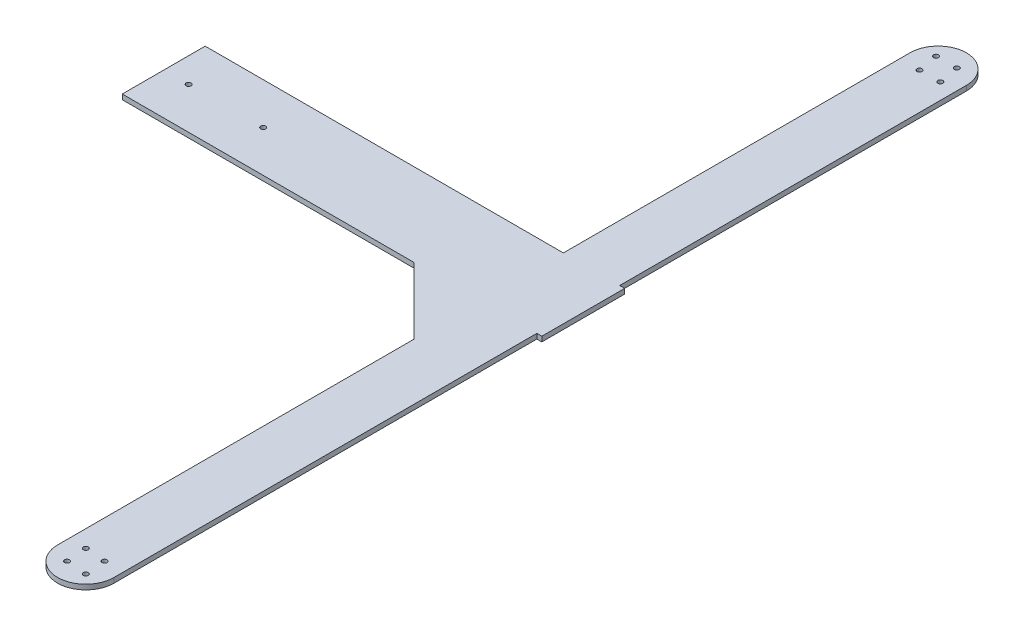
from build123d import *

# Parameters (mm, degrees)
SKETCH1_R           = 1.5
BOSS_EXTRUDE1_DEPTH = 3
SKETCH_3_W          = 50
SKETCH_3_H          = 3
EXTRUDE_1_DEPTH     = 3
SKETCH_4_R          = 1.5
CUT_EXTRUDE_1_DEPTH = 10
EXTRUDE_START       = -3
SKETCH_5_R          = 1.5
EXTRUDE_2_DEPTH     = 3


with BuildPart() as part:
    # Sketch1 → Boss-Extrude1 (new body)
    with BuildSketch(Plane(origin=(0, 0, 0), x_dir=(1, 0, 0), z_dir=(0, 1, 0))):
        with BuildLine():
            Line((0, 50), (0, 0))
            Line((0, 0), (176, 0))
            Line((176, 0), (216, -40))
            Line((216, -40), (216, -255))
            ThreePointArc((216, -255), (233, -272), (250, -255))
            Line((250, -255), (250, 259.060301809))
            ThreePointArc((250, 259.060301809), (233, 276.060301809), (216, 259.060301809))
            Line((216, 259.060301809), (216, 50))
            Line((216, 50), (0, 50))
        make_face()
        with Locations((227.343145751, -260.656854249)):
            Circle(SKETCH1_R, mode=Mode.SUBTRACT)
        with Locations((226.282485579, -248.282485579)):
            Circle(SKETCH1_R, mode=Mode.SUBTRACT)
        with Locations((239.717514421, -261.717514421)):
            Circle(SKETCH1_R, mode=Mode.SUBTRACT)
        with Locations((238.656854249, -249.343145751)):
            Circle(SKETCH1_R, mode=Mode.SUBTRACT)
        with Locations((15, 25)):
            Circle(SKETCH1_R, mode=Mode.SUBTRACT)
        with Locations((50, 25)):
            Circle(SKETCH1_R, mode=Mode.SUBTRACT)
        with Locations((227.907830631, 252.890227975)):
            Circle(SKETCH1_R, mode=Mode.SUBTRACT)
        with Locations((225.673037322, 265.107252935)):
            Circle(SKETCH1_R, mode=Mode.SUBTRACT)
        with Locations((240.326962678, 253.013350683)):
            Circle(SKETCH1_R, mode=Mode.SUBTRACT)
        with Locations((238.092169369, 265.230375643)):
            Circle(SKETCH1_R, mode=Mode.SUBTRACT)
    extrude(amount=BOSS_EXTRUDE1_DEPTH)

    # Эскиз3 → Бобышка-Вытянуть1 (add)
    with BuildSketch(Plane(origin=(250, 0, 0), x_dir=(0, 0, -1), z_dir=(1, 0, 0))):
        with Locations((25, 1.5)):
            Rectangle(SKETCH_3_W, SKETCH_3_H)
    extrude(amount=EXTRUDE_1_DEPTH)

    # Эскиз4 → Вырез-Вытянуть1 (cut)
    with BuildSketch(Plane(origin=(0, 3, 0), x_dir=(1, 0, 0), z_dir=(0, 1, 0))):
        with Locations((60, 25)):
            Circle(SKETCH_4_R)
    extrude(amount=-CUT_EXTRUDE_1_DEPTH, mode=Mode.SUBTRACT)

    # Эскиз5 → Бобышка-Вытянуть2 (add)
    with BuildSketch(Plane(origin=(0, 3, 0), x_dir=(1, 0, 0), z_dir=(0, 1, 0)).offset(EXTRUDE_START)):
        with Locations((50, 25)):
            Circle(SKETCH_5_R)
    extrude(amount=EXTRUDE_2_DEPTH)


solid = part.part
